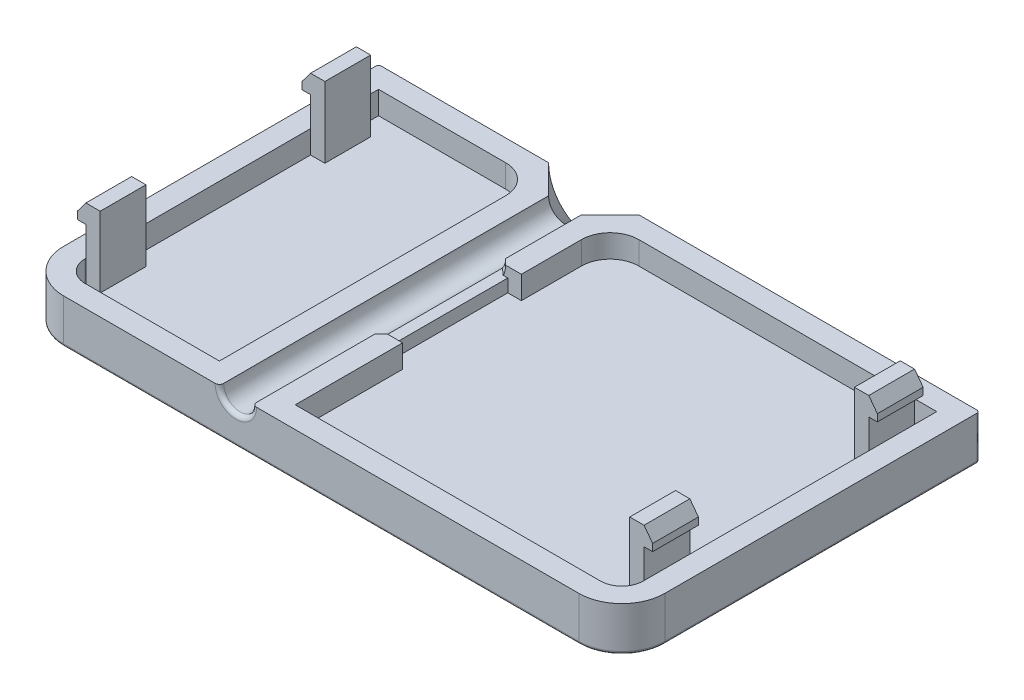
from build123d import *

# Parameters (mm, degrees)
SKETCH_1_W          = 42
SKETCH_1_H          = 25
EXTRUDE_1_DEPTH     = 3.1
SKETCH_3_R          = 1.15
CUT_EXTRUDE_1_DEPTH = 33.796493715
SKETCH_5_W          = 15.7
SKETCH_5_H          = 8.3
CUT_EXTRUDE_3_DEPTH = 1.6
FILLET_4_R          = 3
SKETCH_10_W         = 1.324084548
SKETCH_10_H         = 8.3
CUT_EXTRUDE_4_DEPTH = 0.7
CUT_EXTRUDE_5_DEPTH = 1.6
FILLET_5_R          = 0.3
CHAMFER_1_SIZE      = 0.4
CHAMFER_2_SIZE      = 2
FILLET_6_R          = 2
SKETCH_13_W         = 1
SKETCH_13_H         = 3.2
EXTRUDE_2_DEPTH     = 4.95
EXTRUDE_3_DEPTH     = 3.2
FILLET_7_R          = 0.2
FILLET_8_R          = 0.2


with BuildPart() as part:
    # 草图1 → 凸台-拉伸1 (new body)
    with BuildSketch(Plane(origin=(0, 0, 0), x_dir=(1, 0, 0), z_dir=(0, 1, 0))):
        Rectangle(SKETCH_1_W, SKETCH_1_H)
    extrude(amount=EXTRUDE_1_DEPTH)

    # 草图3 → 切除-拉伸1 (cut, through all)
    with BuildSketch(Plane.XY.offset(12.5)):
        with Locations((-5.97, 3.1)):
            Circle(SKETCH_3_R)
    extrude(amount=-CUT_EXTRUDE_1_DEPTH, mode=Mode.SUBTRACT)

    # 草图5 → 切除-拉伸3 (cut)
    with BuildSketch(Plane(origin=(0, 3.1, 0), x_dir=(1, 0, 0), z_dir=(0, 1, 0))):
        with Locations((3.58, 0.65)):
            Rectangle(SKETCH_5_W, SKETCH_5_H)
    extrude(amount=-CUT_EXTRUDE_3_DEPTH, mode=Mode.SUBTRACT)

    # 圆角4
    fillet_4_edges = [part.edges().sort_by_distance(p)[0] for p in [
        (-21, 1.55, 12.5),
        (21, 1.55, 12.5),
    ]]
    fillet(fillet_4_edges, radius=FILLET_4_R)

    # 草图10 → 切除-拉伸4 (cut)
    with BuildSketch(Plane(origin=(0, 3.1, 0), x_dir=(1, 0, 0), z_dir=(0, 1, 0))):
        with Locations((-4.932042274, 0.65)):
            Rectangle(SKETCH_10_W, SKETCH_10_H)
    extrude(amount=-CUT_EXTRUDE_4_DEPTH, mode=Mode.SUBTRACT)

    # 草图11 → 切除-拉伸5 (cut)
    with BuildSketch(Plane(origin=(0, 3.1, 0), x_dir=(1, 0, 0), z_dir=(0, 1, 0))):
        with BuildLine():
            Line((-3.32, -11), (-3.32, 11))
            Line((-3.32, 11), (19.5, 11))
            Line((19.5, 11), (19.5, -9.5))
            ThreePointArc((19.5, -9.5), (19.060660172, -10.560660172), (18, -11))
            Line((18, -11), (-3.32, -11))
        make_face()
        with BuildLine():
            Line((-19.5, 11), (-8.62, 11))
            Line((-8.62, 11), (-8.62, -11))
            Line((-8.62, -11), (-18, -11))
            ThreePointArc((-18, -11), (-19.060660172, -10.560660172), (-19.5, -9.5))
            Line((-19.5, -9.5), (-19.5, 11))
        make_face()
    extrude(amount=-CUT_EXTRUDE_5_DEPTH, mode=Mode.SUBTRACT)

    # 圆角5
    fillet_5_edges = [part.edges().sort_by_distance(p)[0] for p in [
        (-5.97, 1.95, 12.5),
    ]]
    fillet(fillet_5_edges, radius=FILLET_5_R)

    # 倒角1
    chamfer_1_edges = [part.edges().sort_by_distance(p)[0] for p in [
        (-4.881015028, 2.730389757, 3.5),
        (-4.881015028, 2.730389757, -4.8),
    ]]
    chamfer(chamfer_1_edges, length=CHAMFER_1_SIZE)

    # 倒角2
    # the kernel refuses this chamfer: 2 mm, written as the material it takes off along each edge
    with BuildSketch(Plane(origin=(-5.97, 3.1, -12.5), x_dir=(-0.0031415874858793974, 0.9999950652018581, 0), z_dir=(0.9999950652018581, 0.0031415874858793974, 0))) as chamfer_2_piece_1:
        Polygon((1.15, CHAMFER_2_SIZE), (1.15 + CHAMFER_2_SIZE, 0), (1.15, 0), align=None)
    revolve(axis=Axis((-5.97, 3.1, -12.5), (0, 0, 1)), revolution_arc=359.64, mode=Mode.SUBTRACT)

    # 圆角6
    fillet_6_edges = [part.edges().sort_by_distance(p)[0] for p in [
        (-3.32, 2.3, -11),
        (-8.62, 2.3, -11),
    ]]
    fillet(fillet_6_edges, radius=FILLET_6_R)

    # 草图13 → 凸台-拉伸2 (add)
    with BuildSketch(Plane.XZ.offset(-1.5)):
        with Locations((19, 7.85)):
            Rectangle(SKETCH_13_W, SKETCH_13_H)
        with Locations((19, -7.85)):
            Rectangle(SKETCH_13_W, SKETCH_13_H)
        with Locations((-19, -7.85)):
            Rectangle(SKETCH_13_W, SKETCH_13_H)
        with Locations((-19, 7.85)):
            Rectangle(SKETCH_13_W, SKETCH_13_H)
    extrude(amount=-EXTRUDE_2_DEPTH)

    # 草图14 → 凸台-拉伸3 (add)
    with BuildSketch(Plane(origin=(0, 0, -9.45), x_dir=(-1, 0, 0), z_dir=(0, 0, -1))):
        Polygon((-19.5, 6.45), (-19.5, 5.15), (-20.1, 5.15), (-20.1, 5.65), align=None)
        Polygon((20.1, 5.65), (19.5, 6.45), (19.5, 5.15), (20.1, 5.15), align=None)
    extrude_3 = extrude(amount=-EXTRUDE_3_DEPTH)

    # 镜向1: 凸台-拉伸3 across plane
    add(extrude_3.mirror(Plane.XY))

    # 圆角7
    fillet_7_edges = [part.edges().sort_by_distance(p)[0] for p in [
        (-21, 1.55, -12.5),
        (21, 1.55, -12.5),
    ]]
    fillet(fillet_7_edges, radius=FILLET_7_R)

    # 圆角8
    # the kernel refuses this fillet: 0.2 mm, written as the material it takes off along each edge
    with BuildSketch(Plane(origin=(-20.8, 0, -12.3), x_dir=(0, 0, -1), z_dir=(1, 0, 0))) as fillet_8_piece_1:
        with BuildLine():
            CenterArc((0.2 - FILLET_8_R, FILLET_8_R), FILLET_8_R, 270, 90)
            Line((0.2, FILLET_8_R), (0.2 + FILLET_8_R * 0.02, FILLET_8_R))
            Line((0.2 + FILLET_8_R * 0.02, FILLET_8_R), (0.2 + FILLET_8_R * 0.02, -FILLET_8_R * 0.02))
            Line((0.2 + FILLET_8_R * 0.02, -FILLET_8_R * 0.02), (0.2 - FILLET_8_R, -FILLET_8_R * 0.02))
            Line((0.2 - FILLET_8_R, -FILLET_8_R * 0.02), (0.2 - FILLET_8_R, 0))
        make_face()
    revolve(axis=Axis((-20.8, 0, -12.3), (0, 1, 0)), revolution_arc=90, mode=Mode.SUBTRACT)
    with BuildSketch(Plane(origin=(-21, 0, 9.5), x_dir=(1, 0, 0), z_dir=(0, 0, -1))) as fillet_8_piece_2:
        with BuildLine():
            CenterArc((FILLET_8_R, -FILLET_8_R), FILLET_8_R, 90, 90)
            Line((0, -FILLET_8_R), (-FILLET_8_R * 0.02, -FILLET_8_R))
            Line((-FILLET_8_R * 0.02, -FILLET_8_R), (-FILLET_8_R * 0.02, FILLET_8_R * 0.02))
            Line((-FILLET_8_R * 0.02, FILLET_8_R * 0.02), (FILLET_8_R, FILLET_8_R * 0.02))
            Line((FILLET_8_R, FILLET_8_R * 0.02), (FILLET_8_R, 0))
        make_face()
    extrude(amount=21.8, mode=Mode.SUBTRACT)
    with BuildSketch(Plane(origin=(-18, 0, 9.5), x_dir=(-1, 0, 0), z_dir=(0, 0, -1))) as fillet_8_piece_3:
        with BuildLine():
            CenterArc((3 - FILLET_8_R, FILLET_8_R), FILLET_8_R, 270, 90)
            Line((3, FILLET_8_R), (3 + FILLET_8_R * 0.02, FILLET_8_R))
            Line((3 + FILLET_8_R * 0.02, FILLET_8_R), (3 + FILLET_8_R * 0.02, -FILLET_8_R * 0.02))
            Line((3 + FILLET_8_R * 0.02, -FILLET_8_R * 0.02), (3 - FILLET_8_R, -FILLET_8_R * 0.02))
            Line((3 - FILLET_8_R, -FILLET_8_R * 0.02), (3 - FILLET_8_R, 0))
        make_face()
    revolve(axis=Axis((-18, 0, 9.5), (0, 1, 0)), revolution_arc=90, mode=Mode.SUBTRACT)
    with BuildSketch(Plane(origin=(18, 0, 12.5), x_dir=(0, 1, 0), z_dir=(-1, 0, 0))) as fillet_8_piece_4:
        with BuildLine():
            CenterArc((FILLET_8_R, FILLET_8_R), FILLET_8_R, 180, 90)
            Line((0, FILLET_8_R), (-FILLET_8_R * 0.02, FILLET_8_R))
            Line((-FILLET_8_R * 0.02, FILLET_8_R), (-FILLET_8_R * 0.02, -FILLET_8_R * 0.02))
            Line((-FILLET_8_R * 0.02, -FILLET_8_R * 0.02), (FILLET_8_R, -FILLET_8_R * 0.02))
            Line((FILLET_8_R, -FILLET_8_R * 0.02), (FILLET_8_R, 0))
        make_face()
    extrude(amount=36, mode=Mode.SUBTRACT)
    with BuildSketch(Plane(origin=(18, 0, 9.5), x_dir=(0, 0, 1), z_dir=(-1, 0, 0))) as fillet_8_piece_5:
        with BuildLine():
            CenterArc((3 - FILLET_8_R, FILLET_8_R), FILLET_8_R, 270, 90)
            Line((3 - FILLET_8_R, 0), (3 - FILLET_8_R, -FILLET_8_R * 0.02))
            Line((3 - FILLET_8_R, -FILLET_8_R * 0.02), (3 + FILLET_8_R * 0.02, -FILLET_8_R * 0.02))
            Line((3 + FILLET_8_R * 0.02, -FILLET_8_R * 0.02), (3 + FILLET_8_R * 0.02, FILLET_8_R))
            Line((3 + FILLET_8_R * 0.02, FILLET_8_R), (3, FILLET_8_R))
        make_face()
    revolve(axis=Axis((18, 0, 9.5), (0, 1, 0)), revolution_arc=90, mode=Mode.SUBTRACT)
    with BuildSketch(Plane(origin=(21, 0, -12.3), x_dir=(0, 1, 0), z_dir=(0, 0, 1))) as fillet_8_piece_6:
        with BuildLine():
            CenterArc((FILLET_8_R, FILLET_8_R), FILLET_8_R, 180, 90)
            Line((0, FILLET_8_R), (-FILLET_8_R * 0.02, FILLET_8_R))
            Line((-FILLET_8_R * 0.02, FILLET_8_R), (-FILLET_8_R * 0.02, -FILLET_8_R * 0.02))
            Line((-FILLET_8_R * 0.02, -FILLET_8_R * 0.02), (FILLET_8_R, -FILLET_8_R * 0.02))
            Line((FILLET_8_R, -FILLET_8_R * 0.02), (FILLET_8_R, 0))
        make_face()
    extrude(amount=21.8, mode=Mode.SUBTRACT)
    with BuildSketch(Plane(origin=(20.8, 0, -12.3), x_dir=(0, 0, -1), z_dir=(-1, 0, 0))) as fillet_8_piece_7:
        with BuildLine():
            CenterArc((0.2 - FILLET_8_R, -FILLET_8_R), FILLET_8_R, 0, 90)
            Line((0.2 - FILLET_8_R, 0), (0.2 - FILLET_8_R, FILLET_8_R * 0.02))
            Line((0.2 - FILLET_8_R, FILLET_8_R * 0.02), (0.2 + FILLET_8_R * 0.02, FILLET_8_R * 0.02))
            Line((0.2 + FILLET_8_R * 0.02, FILLET_8_R * 0.02), (0.2 + FILLET_8_R * 0.02, -FILLET_8_R))
            Line((0.2 + FILLET_8_R * 0.02, -FILLET_8_R), (0.2, -FILLET_8_R))
        make_face()
    revolve(axis=Axis((20.8, 0, -12.3), (0, -1, 0)), revolution_arc=90, mode=Mode.SUBTRACT)
    with BuildSketch(Plane(origin=(-6.610983006, 0, -12.5), x_dir=(0, 1, 0), z_dir=(1, 0, 0))) as fillet_8_piece_8:
        with BuildLine():
            CenterArc((FILLET_8_R, FILLET_8_R), FILLET_8_R, 180, 90)
            Line((0, FILLET_8_R), (-FILLET_8_R * 0.02, FILLET_8_R))
            Line((-FILLET_8_R * 0.02, FILLET_8_R), (-FILLET_8_R * 0.02, -FILLET_8_R * 0.02))
            Line((-FILLET_8_R * 0.02, -FILLET_8_R * 0.02), (FILLET_8_R, -FILLET_8_R * 0.02))
            Line((FILLET_8_R, -FILLET_8_R * 0.02), (FILLET_8_R, 0))
        make_face()
    extrude(amount=27.410983006, mode=Mode.SUBTRACT)
    with BuildSketch(Plane(origin=(-20.8, 0, -12.5), x_dir=(0, 0, 1), z_dir=(1, 0, 0))) as fillet_8_piece_9:
        with BuildLine():
            CenterArc((FILLET_8_R, -FILLET_8_R), FILLET_8_R, 90, 90)
            Line((0, -FILLET_8_R), (-FILLET_8_R * 0.02, -FILLET_8_R))
            Line((-FILLET_8_R * 0.02, -FILLET_8_R), (-FILLET_8_R * 0.02, FILLET_8_R * 0.02))
            Line((-FILLET_8_R * 0.02, FILLET_8_R * 0.02), (FILLET_8_R, FILLET_8_R * 0.02))
            Line((FILLET_8_R, FILLET_8_R * 0.02), (FILLET_8_R, 0))
        make_face()
    extrude(amount=15.470983006, mode=Mode.SUBTRACT)


solid = part.part
